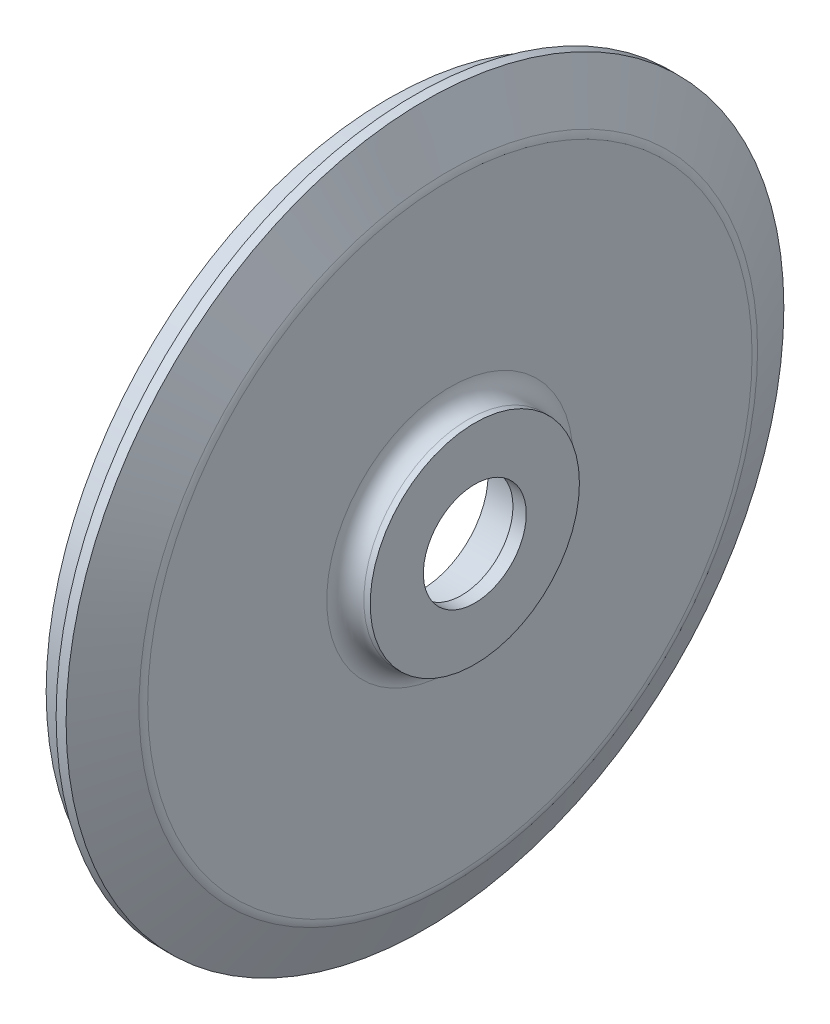
from build123d import *


with BuildPart() as part:
    # Sketch1 → Revolve1 (revolve)
    with BuildSketch(Plane.XY):
        with BuildLine():
            Line((-3.2523385, 15.480769231), (-7.2523385, 15.480769231))
            Line((-7.2523385, 15.480769231), (-7.2523385, 20))
            Line((-7.2523385, 20), (-19.2523385, 20))
            Line((-19.2523385, 20), (-19.2523385, 87.048289024))
            ThreePointArc((-19.2523385, 87.048289024), (-20.716804594, 90.58382293), (-24.2523385, 92.048289024))
            Line((-24.2523385, 92.048289024), (-26.2523385, 92.048289024))
            Line((-26.2523385, 92.048289024), (-26.2523385, 100))
            Line((-26.2523385, 100), (-29.2523385, 100))
            Line((-29.2523385, 100), (-29.2523385, 103))
            Line((-29.2523385, 103), (-21.2523385, 103))
            Line((-21.2523385, 103), (-21.2523385, 108))
            Line((-21.2523385, 108), (-18.2523385, 108))
            Line((-18.2523385, 108), (-11.228146118, 93.071791676))
            ThreePointArc((-11.228146118, 93.071791676), (-10.872740058, 92.033667353), (-10.7523385, 90.94301661))
            Line((-10.7523385, 90.94301661), (-10.7523385, 37.060578593))
            ThreePointArc((-10.7523385, 37.060578593), (-9.118050176, 33.115057555), (-5.172529138, 31.480769231))
            Line((-5.172529138, 31.480769231), (-3.2523385, 31.480769231))
            Line((-3.2523385, 31.480769231), (-3.2523385, 15.480769231))
        make_face()
    revolve(axis=Axis((0, 0, 0), (-1, 0, 0)))


solid = part.part
